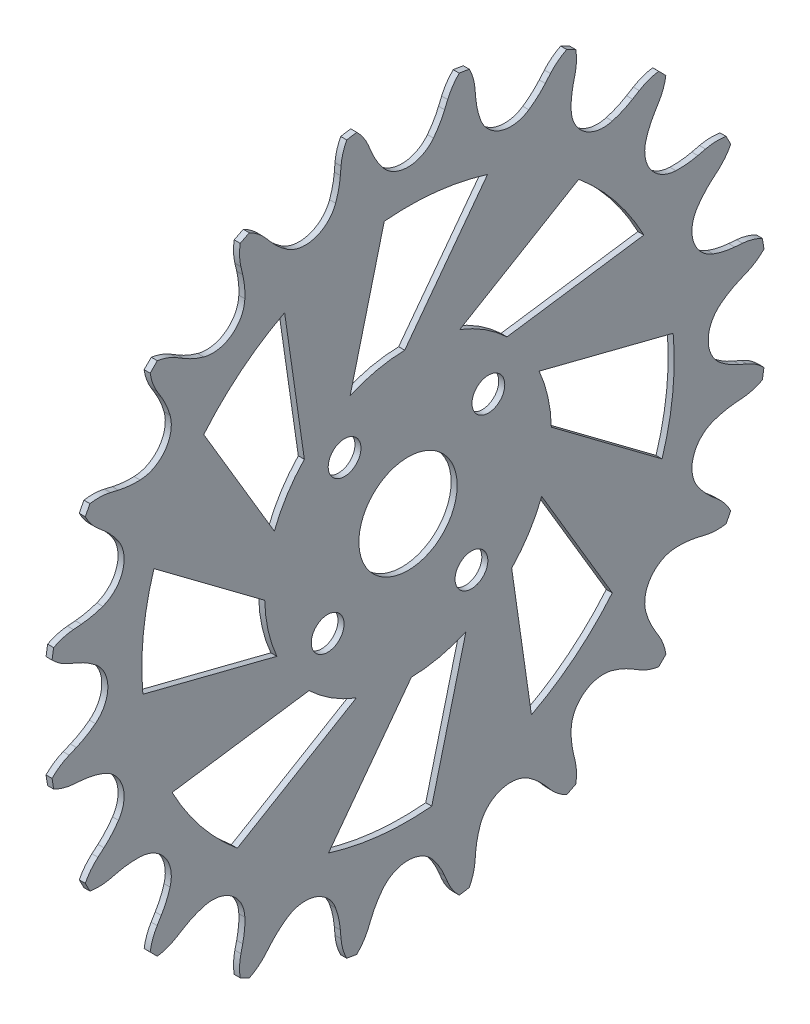
from build123d import *

# Parameters (mm, degrees)
SKETCH1_R               = 119.294138865
SKETCH1_R_2             = 6
BASE_FLANGE1_DEPTH      = 0.7366
SKETCH2_R               = 162.174144392
CUT_EXTRUDE1_DEPTH      = 181.881087596
CUT_EXTRUDE2_DEPTH      = 10
CUT_EXTRUDE5_DEPTH      = 100.806726116
CUT_EXTRUDE5_DEPTH_BACK = 100.806726116
SKETCH7_R               = 2


# Sheet-metal steps are written as plain solids
with BuildPart() as part:
    # Sketch1 → Base-Flange1 (new body)
    with BuildSketch(Plane(origin=(0, 0, 0), x_dir=(0, 0, -1), z_dir=(1, 0, 0))):
        Circle(SKETCH1_R)
        Circle(SKETCH1_R_2, mode=Mode.SUBTRACT)
    extrude(amount=-BASE_FLANGE1_DEPTH)

    # Sketch2 → Cut-Extrude1 (cut, through all)
    with BuildSketch(Plane(origin=(42.183769957, -5.833411124, -4.070791023), x_dir=(0, 0, -1), z_dir=(1, 0, 0))):
        with Locations((-4.070791023, 5.833411124)):
            Circle(SKETCH2_R)
        with BuildLine():
            Line((-12.331353844, 45.715120268), (-12.250579865, 46.677031923))
            ThreePointArc((-12.250579865, 46.677031923), (-12.021081614, 47.919949406), (-11.552014604, 49.093614374))
            ThreePointArc((-11.552014604, 49.093614374), (-10.938627305, 49.195222852), (-10.323862572, 49.288134546))
            ThreePointArc((-10.323862572, 49.288134546), (-9.515070914, 48.316862509), (-8.912722482, 47.205696597))
            Line((-8.912722482, 47.205696597), (-8.538654814, 46.315824781))
            ThreePointArc((-8.538654814, 46.315824781), (-7.935566087, 45.111484422), (-7.178493461, 43.997485881))
            ThreePointArc((-7.178493461, 43.997485881), (-6.853773934, 43.63120562), (-6.486180799, 43.307973059))
            ThreePointArc((-6.486180799, 43.307973059), (-4.070791023, 42.481758127), (-1.655401248, 43.307973059))
            ThreePointArc((-1.655401248, 43.307973059), (-1.287808113, 43.63120562), (-0.963088586, 43.997485881))
            ThreePointArc((-0.963088586, 43.997485881), (-0.206015959, 45.111484422), (0.397072768, 46.315824781))
            Line((0.397072768, 46.315824781), (0.771140435, 47.205696597))
            ThreePointArc((0.771140435, 47.205696597), (1.373488867, 48.316862509), (2.182280525, 49.288134546))
            ThreePointArc((2.182280525, 49.288134546), (2.797045259, 49.195222852), (3.410432557, 49.093614374))
            ThreePointArc((3.410432557, 49.093614374), (3.879499568, 47.919949406), (4.108997819, 46.677031923))
            Line((4.108997819, 46.677031923), (4.189771797, 45.715120268))
            ThreePointArc((4.189771797, 45.715120268), (4.391181623, 44.383359856), (4.766955997, 43.089935977))
            ThreePointArc((4.766955997, 43.089935977), (4.962595794, 42.641238895), (5.212313286, 42.220233936))
            ThreePointArc((5.212313286, 42.220233936), (7.254171016, 40.688060353), (9.806657657, 40.727440959))
            ThreePointArc((9.806657657, 40.727440959), (10.256143857, 40.921260866), (10.678157305, 41.169270244))
            ThreePointArc((10.678157305, 41.169270244), (11.742420641, 41.994797508), (12.688153742, 42.953828588))
            Line((12.688153742, 42.953828588), (13.318898749, 43.684553711))
            ThreePointArc((13.318898749, 43.684553711), (14.2351353, 44.55519939), (15.304481443, 45.229003623))
            ThreePointArc((15.304481443, 45.229003623), (15.860446156, 44.9506666), (16.412413397, 44.664484096))
            ThreePointArc((16.412413397, 44.664484096), (16.495840213, 43.403312703), (16.330023396, 42.150309072))
            Line((16.330023396, 42.150309072), (16.109596966, 41.210516192))
            ThreePointArc((16.109596966, 41.210516192), (15.889612493, 39.881697715), (15.847305201, 38.535457838))
            ThreePointArc((15.847305201, 38.535457838), (15.89471468, 38.048265533), (16.002112442, 37.570699075))
            ThreePointArc((16.002112442, 37.570699075), (17.470566866, 35.482546665), (19.910295194, 34.731238098))
            ThreePointArc((19.910295194, 34.731238098), (20.39767562, 34.776672909), (20.875673371, 34.882134516))
            ThreePointArc((20.875673371, 34.882134516), (22.142949906, 35.338382143), (23.338752437, 35.9582273))
            Line((23.338752437, 35.9582273), (24.164433067, 36.458277264))
            ThreePointArc((24.164433067, 36.458277264), (25.30487012, 37.003177845), (26.530095696, 37.313557621))
            ThreePointArc((26.530095696, 37.313557621), (26.972838689, 36.877040837), (27.409355473, 36.434297844))
            ThreePointArc((27.409355473, 36.434297844), (27.098975697, 35.209072268), (26.554075116, 34.068635214))
            Line((26.554075116, 34.068635214), (26.054025153, 33.242954585))
            ThreePointArc((26.054025153, 33.242954585), (25.434179995, 32.047152054), (24.977932368, 30.779875519))
            ThreePointArc((24.977932368, 30.779875519), (24.872470761, 30.301877768), (24.82703595, 29.814497342))
            ThreePointArc((24.82703595, 29.814497342), (25.578344518, 27.374769013), (27.666496927, 25.906314589))
            ThreePointArc((27.666496927, 25.906314589), (28.144063385, 25.798916828), (28.631255691, 25.751507349))
            ThreePointArc((28.631255691, 25.751507349), (29.977495567, 25.793814641), (31.306314044, 26.013799113))
            Line((31.306314044, 26.013799113), (32.246106924, 26.234225543))
            ThreePointArc((32.246106924, 26.234225543), (33.499110555, 26.400042361), (34.760281949, 26.316615545))
            ThreePointArc((34.760281949, 26.316615545), (35.046464453, 25.764648304), (35.324801475, 25.208683591))
            ThreePointArc((35.324801475, 25.208683591), (34.650997242, 24.139337448), (33.780351563, 23.223100897))
            Line((33.780351563, 23.223100897), (33.04962644, 22.59235589))
            ThreePointArc((33.04962644, 22.59235589), (32.09059536, 21.646622789), (31.265068096, 20.582359453))
            ThreePointArc((31.265068096, 20.582359453), (31.017058718, 20.160346005), (30.823238811, 19.710859804))
            ThreePointArc((30.823238811, 19.710859804), (30.783858205, 17.158373164), (32.316031789, 15.116515434))
            ThreePointArc((32.316031789, 15.116515434), (32.737036747, 14.866797941), (33.185733829, 14.671158145))
            ThreePointArc((33.185733829, 14.671158145), (34.479157709, 14.295383771), (35.81091812, 14.093973945))
            Line((35.81091812, 14.093973945), (36.772829776, 14.013199967))
            ThreePointArc((36.772829776, 14.013199967), (38.015747259, 13.783701716), (39.189412226, 13.314634705))
            ThreePointArc((39.189412226, 13.314634705), (39.291020704, 12.701247406), (39.383932399, 12.086482673))
            ThreePointArc((39.383932399, 12.086482673), (38.412660361, 11.277691015), (37.301494449, 10.675342583))
            Line((37.301494449, 10.675342583), (36.411622633, 10.301274916))
            ThreePointArc((36.411622633, 10.301274916), (35.207282275, 9.698186189), (34.093283733, 8.941113562))
            ThreePointArc((34.093283733, 8.941113562), (33.727003472, 8.616394035), (33.403770911, 8.2488009))
            ThreePointArc((33.403770911, 8.2488009), (32.577555979, 5.833411124), (33.403770911, 3.418021349))
            ThreePointArc((33.403770911, 3.418021349), (33.727003472, 3.050428214), (34.093283733, 2.725708687))
            ThreePointArc((34.093283733, 2.725708687), (35.207282275, 1.96863606), (36.411622633, 1.365547333))
            Line((36.411622633, 1.365547333), (37.301494449, 0.991479666))
            ThreePointArc((37.301494449, 0.991479666), (38.412660361, 0.389131234), (39.383932399, -0.419660424))
            ThreePointArc((39.383932399, -0.419660424), (39.291020704, -1.034425157), (39.189412226, -1.647812456))
            ThreePointArc((39.189412226, -1.647812456), (38.015747259, -2.116879467), (36.772829776, -2.346377718))
            Line((36.772829776, -2.346377718), (35.81091812, -2.427151696))
            ThreePointArc((35.81091812, -2.427151696), (34.479157709, -2.628561522), (33.185733829, -3.004335896))
            ThreePointArc((33.185733829, -3.004335896), (32.737036747, -3.199975693), (32.316031789, -3.449693185))
            ThreePointArc((32.316031789, -3.449693185), (30.783858205, -5.491550915), (30.823238811, -8.044037555))
            ThreePointArc((30.823238811, -8.044037555), (31.017058718, -8.493523756), (31.265068096, -8.915537204))
            ThreePointArc((31.265068096, -8.915537204), (32.09059536, -9.97980054), (33.04962644, -10.925533641))
            Line((33.04962644, -10.925533641), (33.780351563, -11.556278648))
            ThreePointArc((33.780351563, -11.556278648), (34.650997242, -12.472515199), (35.324801475, -13.541861342))
            ThreePointArc((35.324801475, -13.541861342), (35.046464453, -14.097826055), (34.760281949, -14.649793296))
            ThreePointArc((34.760281949, -14.649793296), (33.499110555, -14.733220112), (32.246106924, -14.567403295))
            Line((32.246106924, -14.567403295), (31.306314044, -14.346976865))
            ThreePointArc((31.306314044, -14.346976865), (29.977495567, -14.126992392), (28.631255691, -14.0846851))
            ThreePointArc((28.631255691, -14.0846851), (28.144063385, -14.132094579), (27.666496927, -14.239492341))
            ThreePointArc((27.666496927, -14.239492341), (25.578344518, -15.707946765), (24.82703595, -18.147675093))
            ThreePointArc((24.82703595, -18.147675093), (24.872470761, -18.635055519), (24.977932368, -19.11305327))
            ThreePointArc((24.977932368, -19.11305327), (25.434179995, -20.380329805), (26.054025153, -21.576132336))
            Line((26.054025153, -21.576132336), (26.554075116, -22.401812965))
            ThreePointArc((26.554075116, -22.401812965), (27.098975697, -23.542250019), (27.409355473, -24.767475595))
            ThreePointArc((27.409355473, -24.767475595), (26.972838689, -25.210218588), (26.530095696, -25.646735372))
            ThreePointArc((26.530095696, -25.646735372), (25.30487012, -25.336355596), (24.164433067, -24.791455015))
            Line((24.164433067, -24.791455015), (23.338752437, -24.291405051))
            ThreePointArc((23.338752437, -24.291405051), (22.142949906, -23.671559894), (20.875673371, -23.215312267))
            ThreePointArc((20.875673371, -23.215312267), (20.39767562, -23.10985066), (19.910295194, -23.064415849))
            ThreePointArc((19.910295194, -23.064415849), (17.470566866, -23.815724416), (16.002112442, -25.903876826))
            ThreePointArc((16.002112442, -25.903876826), (15.89471468, -26.381443284), (15.847305201, -26.86863559))
            ThreePointArc((15.847305201, -26.86863559), (15.889612493, -28.214875466), (16.109596966, -29.543693943))
            Line((16.109596966, -29.543693943), (16.330023396, -30.483486823))
            ThreePointArc((16.330023396, -30.483486823), (16.495840213, -31.736490454), (16.412413397, -32.997661847))
            ThreePointArc((16.412413397, -32.997661847), (15.860446156, -33.283844351), (15.304481443, -33.562181374))
            ThreePointArc((15.304481443, -33.562181374), (14.2351353, -32.888377141), (13.318898749, -32.017731462))
            Line((13.318898749, -32.017731462), (12.688153742, -31.287006339))
            ThreePointArc((12.688153742, -31.287006339), (11.742420641, -30.327975259), (10.678157305, -29.502447995))
            ThreePointArc((10.678157305, -29.502447995), (10.256143857, -29.254438617), (9.806657657, -29.06061871))
            ThreePointArc((9.806657657, -29.06061871), (7.254171016, -29.021238104), (5.212313286, -30.553411688))
            ThreePointArc((5.212313286, -30.553411688), (4.962595794, -30.974416646), (4.766955997, -31.423113728))
            ThreePointArc((4.766955997, -31.423113728), (4.391181623, -32.716537607), (4.189771797, -34.048298019))
            Line((4.189771797, -34.048298019), (4.108997819, -35.010209674))
            ThreePointArc((4.108997819, -35.010209674), (3.879499568, -36.253127158), (3.410432557, -37.426792125))
            ThreePointArc((3.410432557, -37.426792125), (2.797045259, -37.528400603), (2.182280525, -37.621312297))
            ThreePointArc((2.182280525, -37.621312297), (1.373488867, -36.65004026), (0.771140435, -35.538874348))
            Line((0.771140435, -35.538874348), (0.397072768, -34.649002532))
            ThreePointArc((0.397072768, -34.649002532), (-0.206015959, -33.444662174), (-0.963088586, -32.330663632))
            ThreePointArc((-0.963088586, -32.330663632), (-1.287808113, -31.964383371), (-1.655401248, -31.64115081))
            ThreePointArc((-1.655401248, -31.64115081), (-4.070791023, -30.814935878), (-6.486180799, -31.64115081))
            ThreePointArc((-6.486180799, -31.64115081), (-6.853773934, -31.964383371), (-7.178493461, -32.330663632))
            ThreePointArc((-7.178493461, -32.330663632), (-7.935566087, -33.444662174), (-8.538654814, -34.649002532))
            Line((-8.538654814, -34.649002532), (-8.912722482, -35.538874348))
            ThreePointArc((-8.912722482, -35.538874348), (-9.515070914, -36.65004026), (-10.323862572, -37.621312297))
            ThreePointArc((-10.323862572, -37.621312297), (-10.938627305, -37.528400603), (-11.552014604, -37.426792125))
            ThreePointArc((-11.552014604, -37.426792125), (-12.021081614, -36.253127158), (-12.250579865, -35.010209674))
            Line((-12.250579865, -35.010209674), (-12.331353844, -34.048298019))
            ThreePointArc((-12.331353844, -34.048298019), (-12.53276367, -32.716537607), (-12.908538044, -31.423113728))
            ThreePointArc((-12.908538044, -31.423113728), (-13.10417784, -30.974416646), (-13.353895333, -30.553411688))
            ThreePointArc((-13.353895333, -30.553411688), (-15.395753063, -29.021238104), (-17.948239703, -29.06061871))
            ThreePointArc((-17.948239703, -29.06061871), (-18.397725904, -29.254438617), (-18.819739351, -29.502447995))
            ThreePointArc((-18.819739351, -29.502447995), (-19.884002687, -30.327975259), (-20.829735789, -31.287006339))
            Line((-20.829735789, -31.287006339), (-21.460480795, -32.017731462))
            ThreePointArc((-21.460480795, -32.017731462), (-22.376717347, -32.888377141), (-23.446063489, -33.562181374))
            ThreePointArc((-23.446063489, -33.562181374), (-24.002028203, -33.283844351), (-24.553995443, -32.997661847))
            ThreePointArc((-24.553995443, -32.997661847), (-24.63742226, -31.736490454), (-24.471605442, -30.483486823))
            Line((-24.471605442, -30.483486823), (-24.251179012, -29.543693943))
            ThreePointArc((-24.251179012, -29.543693943), (-24.03119454, -28.214875466), (-23.988887247, -26.86863559))
            ThreePointArc((-23.988887247, -26.86863559), (-24.036296727, -26.381443284), (-24.143694488, -25.903876826))
            ThreePointArc((-24.143694488, -25.903876826), (-25.612148912, -23.815724416), (-28.051877241, -23.064415849))
            ThreePointArc((-28.051877241, -23.064415849), (-28.539257666, -23.10985066), (-29.017255418, -23.215312267))
            ThreePointArc((-29.017255418, -23.215312267), (-30.284531953, -23.671559894), (-31.480334483, -24.291405051))
            Line((-31.480334483, -24.291405051), (-32.306015113, -24.791455015))
            ThreePointArc((-32.306015113, -24.791455015), (-33.446452167, -25.336355596), (-34.671677743, -25.646735372))
            ThreePointArc((-34.671677743, -25.646735372), (-35.114420736, -25.210218588), (-35.55093752, -24.767475595))
            ThreePointArc((-35.55093752, -24.767475595), (-35.240557744, -23.542250019), (-34.695657163, -22.401812965))
            Line((-34.695657163, -22.401812965), (-34.195607199, -21.576132336))
            ThreePointArc((-34.195607199, -21.576132336), (-33.575762042, -20.380329805), (-33.119514415, -19.11305327))
            ThreePointArc((-33.119514415, -19.11305327), (-33.014052808, -18.635055519), (-32.968617997, -18.147675093))
            ThreePointArc((-32.968617997, -18.147675093), (-33.719926564, -15.707946765), (-35.808078974, -14.239492341))
            ThreePointArc((-35.808078974, -14.239492341), (-36.285645432, -14.132094579), (-36.772837737, -14.0846851))
            ThreePointArc((-36.772837737, -14.0846851), (-38.119077614, -14.126992392), (-39.44789609, -14.346976865))
            Line((-39.44789609, -14.346976865), (-40.387688971, -14.567403295))
            ThreePointArc((-40.387688971, -14.567403295), (-41.640692602, -14.733220112), (-42.901863995, -14.649793296))
            ThreePointArc((-42.901863995, -14.649793296), (-43.188046499, -14.097826055), (-43.466383522, -13.541861342))
            ThreePointArc((-43.466383522, -13.541861342), (-42.792579289, -12.472515199), (-41.92193361, -11.556278648))
            Line((-41.92193361, -11.556278648), (-41.191208487, -10.925533641))
            ThreePointArc((-41.191208487, -10.925533641), (-40.232177407, -9.97980054), (-39.406650143, -8.915537204))
            ThreePointArc((-39.406650143, -8.915537204), (-39.158640765, -8.493523756), (-38.964820858, -8.044037555))
            ThreePointArc((-38.964820858, -8.044037555), (-38.925440251, -5.491550915), (-40.457613835, -3.449693185))
            ThreePointArc((-40.457613835, -3.449693185), (-40.878618794, -3.199975693), (-41.327315876, -3.004335896))
            ThreePointArc((-41.327315876, -3.004335896), (-42.620739755, -2.628561522), (-43.952500167, -2.427151696))
            Line((-43.952500167, -2.427151696), (-44.914411822, -2.346377718))
            ThreePointArc((-44.914411822, -2.346377718), (-46.157329305, -2.116879467), (-47.330994273, -1.647812456))
            ThreePointArc((-47.330994273, -1.647812456), (-47.43260275, -1.034425157), (-47.525514445, -0.419660424))
            ThreePointArc((-47.525514445, -0.419660424), (-46.554242408, 0.389131234), (-45.443076496, 0.991479666))
            Line((-45.443076496, 0.991479666), (-44.55320468, 1.365547333))
            ThreePointArc((-44.55320468, 1.365547333), (-43.348864321, 1.96863606), (-42.23486578, 2.725708687))
            ThreePointArc((-42.23486578, 2.725708687), (-41.868585518, 3.050428214), (-41.545352958, 3.418021349))
            ThreePointArc((-41.545352958, 3.418021349), (-40.719138026, 5.833411124), (-41.545352958, 8.2488009))
            ThreePointArc((-41.545352958, 8.2488009), (-41.868585518, 8.616394035), (-42.23486578, 8.941113562))
            ThreePointArc((-42.23486578, 8.941113562), (-43.348864321, 9.698186189), (-44.55320468, 10.301274916))
            Line((-44.55320468, 10.301274916), (-45.443076496, 10.675342583))
            ThreePointArc((-45.443076496, 10.675342583), (-46.554242408, 11.277691015), (-47.525514445, 12.086482673))
            ThreePointArc((-47.525514445, 12.086482673), (-47.43260275, 12.701247406), (-47.330994273, 13.314634705))
            ThreePointArc((-47.330994273, 13.314634705), (-46.157329305, 13.783701716), (-44.914411822, 14.013199967))
            Line((-44.914411822, 14.013199967), (-43.952500167, 14.093973945))
            ThreePointArc((-43.952500167, 14.093973945), (-42.620739755, 14.295383771), (-41.327315876, 14.671158145))
            ThreePointArc((-41.327315876, 14.671158145), (-40.878618794, 14.866797941), (-40.457613835, 15.116515434))
            ThreePointArc((-40.457613835, 15.116515434), (-38.925440251, 17.158373164), (-38.964820858, 19.710859804))
            ThreePointArc((-38.964820858, 19.710859804), (-39.158640765, 20.160346005), (-39.406650143, 20.582359453))
            ThreePointArc((-39.406650143, 20.582359453), (-40.232177407, 21.646622789), (-41.191208487, 22.59235589))
            Line((-41.191208487, 22.59235589), (-41.92193361, 23.223100897))
            ThreePointArc((-41.92193361, 23.223100897), (-42.792579289, 24.139337448), (-43.466383522, 25.208683591))
            ThreePointArc((-43.466383522, 25.208683591), (-43.188046499, 25.764648304), (-42.901863995, 26.316615545))
            ThreePointArc((-42.901863995, 26.316615545), (-41.640692602, 26.400042361), (-40.387688971, 26.234225543))
            Line((-40.387688971, 26.234225543), (-39.44789609, 26.013799113))
            ThreePointArc((-39.44789609, 26.013799113), (-38.119077614, 25.793814641), (-36.772837737, 25.751507349))
            ThreePointArc((-36.772837737, 25.751507349), (-36.285645432, 25.798916828), (-35.808078974, 25.906314589))
            ThreePointArc((-35.808078974, 25.906314589), (-33.719926564, 27.374769013), (-32.968617997, 29.814497342))
            ThreePointArc((-32.968617997, 29.814497342), (-33.014052808, 30.301877768), (-33.119514415, 30.779875519))
            ThreePointArc((-33.119514415, 30.779875519), (-33.575762042, 32.047152054), (-34.195607199, 33.242954585))
            Line((-34.195607199, 33.242954585), (-34.695657163, 34.068635214))
            ThreePointArc((-34.695657163, 34.068635214), (-35.240557744, 35.209072268), (-35.55093752, 36.434297844))
            ThreePointArc((-35.55093752, 36.434297844), (-35.114420736, 36.877040837), (-34.671677743, 37.313557621))
            ThreePointArc((-34.671677743, 37.313557621), (-33.446452167, 37.003177845), (-32.306015113, 36.458277264))
            Line((-32.306015113, 36.458277264), (-31.480334483, 35.9582273))
            ThreePointArc((-31.480334483, 35.9582273), (-30.284531953, 35.338382143), (-29.017255418, 34.882134516))
            ThreePointArc((-29.017255418, 34.882134516), (-28.539257666, 34.776672909), (-28.051877241, 34.731238098))
            ThreePointArc((-28.051877241, 34.731238098), (-25.612148912, 35.482546665), (-24.143694488, 37.570699075))
            ThreePointArc((-24.143694488, 37.570699075), (-24.036296727, 38.048265533), (-23.988887247, 38.535457838))
            ThreePointArc((-23.988887247, 38.535457838), (-24.03119454, 39.881697715), (-24.251179012, 41.210516192))
            Line((-24.251179012, 41.210516192), (-24.471605442, 42.150309072))
            ThreePointArc((-24.471605442, 42.150309072), (-24.63742226, 43.403312703), (-24.553995443, 44.664484096))
            ThreePointArc((-24.553995443, 44.664484096), (-24.002028203, 44.9506666), (-23.446063489, 45.229003623))
            ThreePointArc((-23.446063489, 45.229003623), (-22.376717347, 44.55519939), (-21.460480795, 43.684553711))
            Line((-21.460480795, 43.684553711), (-20.829735789, 42.953828588))
            ThreePointArc((-20.829735789, 42.953828588), (-19.884002687, 41.994797508), (-18.819739351, 41.169270244))
            ThreePointArc((-18.819739351, 41.169270244), (-18.397725904, 40.921260866), (-17.948239703, 40.727440959))
            ThreePointArc((-17.948239703, 40.727440959), (-15.395753063, 40.688060353), (-13.353895333, 42.220233936))
            ThreePointArc((-13.353895333, 42.220233936), (-13.10417784, 42.641238895), (-12.908538044, 43.089935977))
            ThreePointArc((-12.908538044, 43.089935977), (-12.53276367, 44.383359856), (-12.331353844, 45.715120268))
        make_face(mode=Mode.SUBTRACT)
    extrude(amount=-CUT_EXTRUDE1_DEPTH, mode=Mode.SUBTRACT)

    # Sketch4 → Cut-Extrude2 (cut)
    with BuildSketch(Plane(origin=(0, 0, 0), x_dir=(0, 0, -1), z_dir=(1, 0, 0))):
        with BuildLine():
            ThreePointArc((7.068617585, -16.008892699), (3.809616049, -17.080305195), (0.404213104, -17.495331142))
            Line((0.404213104, -17.495331142), (-9.708213805, -31.016134264))
            ThreePointArc((-9.708213805, -31.016134264), (-3.470725578, -32.314146499), (2.900140687, -32.370344206))
            Line((2.900140687, -32.370344206), (7.068617585, -16.008892699))
        make_face()
        with BuildLine():
            ThreePointArc((16.318264015, -6.321729158), (14.77140497, -9.383794286), (12.656889116, -12.085245463))
            Line((12.656889116, -12.085245463), (15.06697505, -28.796462679))
            ThreePointArc((15.06697505, -28.796462679), (20.395378526, -25.303725709), (24.939999043, -20.838580751))
            Line((24.939999043, -20.838580751), (16.318264015, -6.321729158))
        make_face()
        with BuildLine():
            ThreePointArc((-6.321729158, -16.318264015), (-9.383794286, -14.77140497), (-12.085245463, -12.656889116))
            Line((-12.085245463, -12.656889116), (-28.796462679, -15.06697505))
            ThreePointArc((-28.796462679, -15.06697505), (-25.303725709, -20.395378526), (-20.838580751, -24.939999043))
            Line((-20.838580751, -24.939999043), (-6.321729158, -16.318264015))
        make_face()
        with BuildLine():
            Line((-32.370344206, -2.900140687), (-16.008892699, -7.068617585))
            ThreePointArc((-16.008892699, -7.068617585), (-17.080305195, -3.809616049), (-17.495331142, -0.404213104))
            Line((-17.495331142, -0.404213104), (-31.016134264, 9.708213805))
            ThreePointArc((-31.016134264, 9.708213805), (-32.314146499, 3.470725578), (-32.370344206, -2.900140687))
        make_face()
        with BuildLine():
            Line((-24.939999043, 20.838580751), (-16.318264015, 6.321729158))
            ThreePointArc((-16.318264015, 6.321729158), (-14.77140497, 9.383794286), (-12.656889116, 12.085245463))
            Line((-12.656889116, 12.085245463), (-15.06697505, 28.796462679))
            ThreePointArc((-15.06697505, 28.796462679), (-20.395378526, 25.303725709), (-24.939999043, 20.838580751))
        make_face()
        with BuildLine():
            Line((-2.900140687, 32.370344206), (-7.068617585, 16.008892699))
            ThreePointArc((-7.068617585, 16.008892699), (-3.809616049, 17.080305195), (-0.404213104, 17.495331142))
            Line((-0.404213104, 17.495331142), (9.708213805, 31.016134264))
            ThreePointArc((9.708213805, 31.016134264), (3.470725578, 32.314146499), (-2.900140687, 32.370344206))
        make_face()
        with BuildLine():
            Line((20.838580751, 24.939999043), (6.321729158, 16.318264015))
            ThreePointArc((6.321729158, 16.318264015), (9.383794286, 14.77140497), (12.085245463, 12.656889116))
            Line((12.085245463, 12.656889116), (28.796462679, 15.06697505))
            ThreePointArc((28.796462679, 15.06697505), (25.303725709, 20.395378526), (20.838580751, 24.939999043))
        make_face()
        with BuildLine():
            Line((17.495331142, 0.404213104), (31.016134264, -9.708213805))
            ThreePointArc((31.016134264, -9.708213805), (32.126891879, -4.910480445), (32.5, 0))
            ThreePointArc((32.5, 0), (32.467569871, 1.451518742), (32.370344206, 2.900140687))
            Line((32.370344206, 2.900140687), (16.008892699, 7.068617585))
            ThreePointArc((16.008892699, 7.068617585), (17.080305195, 3.809616049), (17.495331142, 0.404213104))
        make_face()
    extrude(amount=-CUT_EXTRUDE2_DEPTH, mode=Mode.SUBTRACT)

    # Sketch7 → Cut-Extrude5 (cut, two sides: drawn at the far end of the back side and taken through both)
    with BuildSketch(Plane(origin=(0, -41.954104349, 8.180266044), x_dir=(0, 0, 1), z_dir=(-1, 0, 0)).offset(-CUT_EXTRUDE5_DEPTH_BACK)):
        with Locations(Location((1.631228511, 34.209133427, 0), (0, 0, 270))):
            Circle(SKETCH7_R)
        with Locations(Location((-15.925236966, 32.142609794, 0), (0, 0, 270))):
            Circle(SKETCH7_R)
        with Locations(Location((-17.991760599, 49.699075272, 0), (0, 0, 270))):
            Circle(SKETCH7_R)
        with Locations(Location((-0.435295121, 51.765598904, 0), (0, 0, 270))):
            Circle(SKETCH7_R)
    extrude(amount=CUT_EXTRUDE5_DEPTH + CUT_EXTRUDE5_DEPTH_BACK, mode=Mode.SUBTRACT)


solid = part.part
